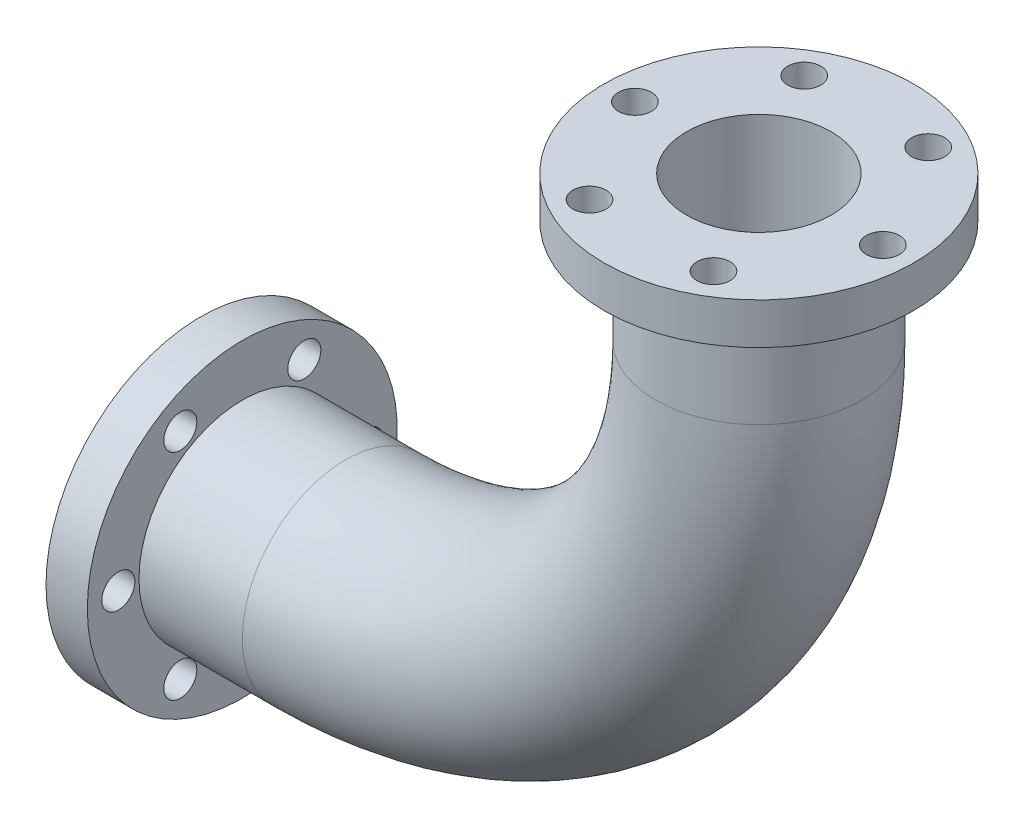
from build123d import *

# Parameters (mm, degrees)
SKETCH2_R             = 50
SKETCH2_R_2           = 35
SKETCH3_R             = 75
SKETCH3_R_2           = 35
BOSS_EXTRUDE1_DEPTH   = 20
BOSS_EXTRUDE2_START   = -20
SKETCH4_R             = 75
SKETCH4_R_2           = 35
BOSS_EXTRUDE2_DEPTH   = 20
HOLE1_D               = 16
CIRPATTERN1_OUTLINE_R = 8
CIRPATTERN1_DEPTH     = 20
HOLE2_D               = 16
CIRPATTERN2_START     = 250
CIRPATTERN2_OUTLINE_R = 8
CIRPATTERN2_DEPTH     = 20


# Read off the part's stored shape, not the designer's step: CirPattern1, CirPattern2
with BuildPart() as part:
    # Sweep1: sweep along a path in Sketch1
    with BuildLine(Plane.XY) as sweep1_path:
        Line((0, 0), (70, 0))
        ThreePointArc((70, 0), (211.421356237, 58.578643763), (270, 200))
        Line((270, 200), (270, 270))
    # Sketch2 → Sweep1 (sweep)
    with BuildSketch(Plane(origin=(0, 0, 0), x_dir=(0, 0, -1), z_dir=(1, 0, 0))):
        Circle(SKETCH2_R)
        Circle(SKETCH2_R_2, mode=Mode.SUBTRACT)
    sweep(path=sweep1_path.line)

    # Sketch3 → Boss-Extrude1 (add)
    with BuildSketch(Plane(origin=(0, 270, 0), x_dir=(1, 0, 0), z_dir=(0, 1, 0))):
        with Locations(Location((270, 0, 0), (0, 0, 270))):
            Circle(SKETCH3_R)
        with Locations((270, 0)):
            Circle(SKETCH3_R_2, mode=Mode.SUBTRACT)
    extrude(amount=-BOSS_EXTRUDE1_DEPTH)

    # Sketch4 → Boss-Extrude2 (add)
    with BuildSketch(Plane.ZY.offset(BOSS_EXTRUDE2_START)):
        Circle(SKETCH4_R)
        with Locations(Location((0, 0, 0), (0, 0, 180))):
            Circle(SKETCH4_R_2, mode=Mode.SUBTRACT)
    extrude(amount=BOSS_EXTRUDE2_DEPTH)

    # Hole1 (through all)
    with Locations(Plane.ZY):
        with Locations((60, 0)):
            Hole(HOLE1_D / 2)

    # CirPattern1 outline → CirPattern1 (cut)
    with BuildSketch(Plane.YZ):
        with Locations((51.961524227, 30)):
            Circle(CIRPATTERN1_OUTLINE_R)
        with Locations((51.961524227, -30)):
            Circle(CIRPATTERN1_OUTLINE_R)
        with Locations((0, -60)):
            Circle(CIRPATTERN1_OUTLINE_R)
        with Locations((-51.961524227, -30)):
            Circle(CIRPATTERN1_OUTLINE_R)
        with Locations((-51.961524227, 30)):
            Circle(CIRPATTERN1_OUTLINE_R)
    extrude(amount=CIRPATTERN1_DEPTH, mode=Mode.SUBTRACT)

    # Hole2 (through all)
    with Locations(Plane(origin=(0, 270, 0), x_dir=(1, 0, 0), z_dir=(0, 1, 0))):
        with Locations((330, 0)):
            Hole(HOLE2_D / 2)

    # CirPattern2 outline → CirPattern2 (cut)
    with BuildSketch(Plane(origin=(0, 0, 0), x_dir=(1, 0, 0), z_dir=(0, 1, 0)).offset(CIRPATTERN2_START)):
        with Locations((300, -51.961524227)):
            Circle(CIRPATTERN2_OUTLINE_R)
        with Locations((240, -51.961524227)):
            Circle(CIRPATTERN2_OUTLINE_R)
        with Locations((210, 0)):
            Circle(CIRPATTERN2_OUTLINE_R)
        with Locations((240, 51.961524227)):
            Circle(CIRPATTERN2_OUTLINE_R)
        with Locations((300, 51.961524227)):
            Circle(CIRPATTERN2_OUTLINE_R)
    extrude(amount=CIRPATTERN2_DEPTH, mode=Mode.SUBTRACT)


solid = part.part
